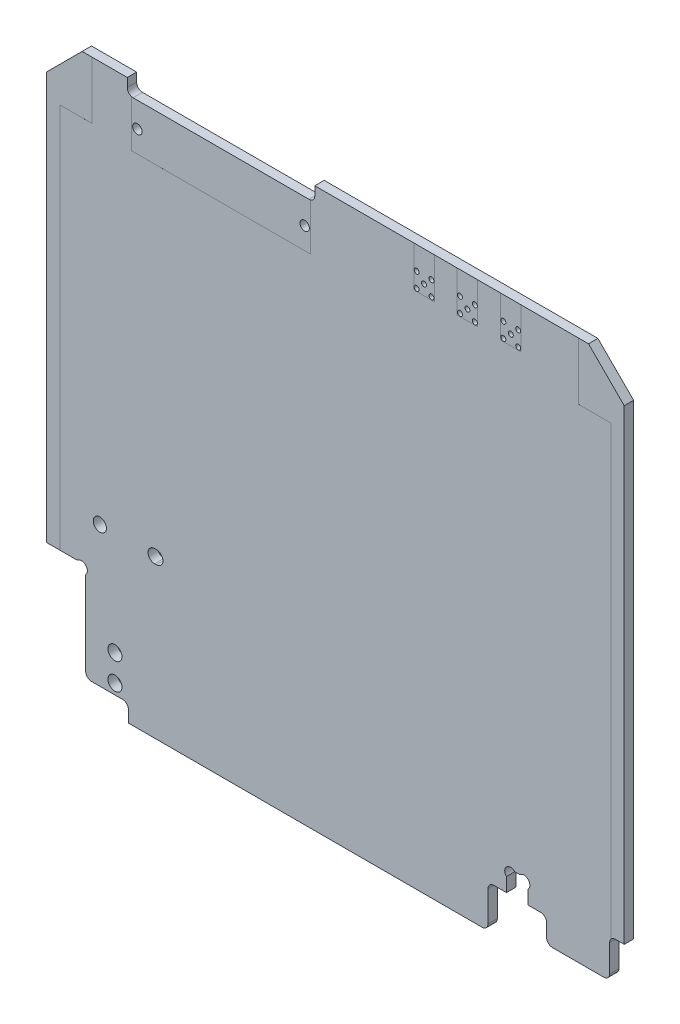
from build123d import *

# Parameters (mm, degrees)
SKETCH1_R           = 0.425
SKETCH1_R_2         = 0.8
BOSS_EXTRUDE1_DEPTH = 1.6
CUT_EXTRUDE1_DEPTH  = 0.0001
CUT_EXTRUDE2_DEPTH  = 0.0001
PARTFOOTPRINTS_W    = 30.48
PARTFOOTPRINTS_H    = 7.989227112
PARTFOOTPRINTS_W_2  = 3.5
PARTFOOTPRINTS_H_2  = 6.95
CUT_EXTRUDE3_DEPTH  = 0.0001
CUT_EXTRUDE4_DEPTH  = 71.235674696
SKETCH3_W           = 7.779754111
SKETCH3_H           = 5.155241991
CUT_EXTRUDE5_DEPTH  = 10
FILLET1_R           = 1
CUT_EXTRUDE6_DEPTH  = 71.235674696
FILLET2_R           = 1
SKETCH5_R           = 1.125
CUT_EXTRUDE7_DEPTH  = 71.235674696
SKETCH6_R           = 1.2
CUT_EXTRUDE8_DEPTH  = 71.235674696


with BuildPart() as part:
    # Sketch1 → Boss-Extrude1 (new body)
    with BuildSketch(Plane(origin=(0, 0, -0.0125), x_dir=(-1, 0, 0), z_dir=(0, 0, -1))):
        with BuildLine():
            Line((35.3, -50), (35.3, -48))
            ThreePointArc((35.3, -48), (35.592893219, -47.292893219), (36.3, -47))
            Line((36.3, -47), (45.8, -47))
            ThreePointArc((45.8, -47), (46.507106781, -46.707106781), (46.8, -46))
            Line((46.8, -46), (46.8, -41.4))
            ThreePointArc((46.8, -41.4), (47.092893219, -40.692893219), (47.8, -40.4))
            Line((47.8, -40.4), (49.3, -40.4))
            Line((49.3, -40.4), (49.3, 39.2))
            Line((49.3, 39.2), (43.2, 45.3))
            Line((43.2, 45.3), (35.500000002, 45.3))
            Line((35.500000002, 45.3), (35.500000002, 43.8))
            ThreePointArc((35.500000002, 43.8), (35.207106783, 43.092893219), (34.500000002, 42.8))
            Line((34.500000002, 42.8), (4.499999998, 42.8))
            ThreePointArc((4.499999998, 42.8), (3.792893217, 43.092893219), (3.499999998, 43.8))
            Line((3.499999998, 43.8), (3.499999998, 45.3))
            Line((3.499999998, 45.3), (-43.2, 45.3))
            Line((-43.2, 45.3), (-49.3, 39.2))
            Line((-49.3, 39.2), (-49.3, -40.4))
            Line((-49.3, -40.4), (-47.8, -40.4))
            ThreePointArc((-47.8, -40.4), (-47.092893219, -40.692893219), (-46.8, -41.4))
            Line((-46.8, -41.4), (-46.8, -46))
            ThreePointArc((-46.8, -46), (-46.507106781, -46.707106781), (-45.8, -47))
            Line((-45.8, -47), (-36.3, -47))
            ThreePointArc((-36.3, -47), (-35.592893219, -47.292893219), (-35.3, -48))
            Line((-35.3, -48), (-35.3, -50))
            Line((-35.3, -50), (35.3, -50))
        make_face()
        with Locations((-21.27, 41.37)):
            Circle(SKETCH1_R, mode=Mode.SUBTRACT)
        with Locations((-23.81, 41.37)):
            Circle(SKETCH1_R, mode=Mode.SUBTRACT)
        with Locations((-22.54, 40.1)):
            Circle(SKETCH1_R, mode=Mode.SUBTRACT)
        with Locations((-13.87, 41.37)):
            Circle(SKETCH1_R, mode=Mode.SUBTRACT)
        with Locations((-23.81, 38.83)):
            Circle(SKETCH1_R, mode=Mode.SUBTRACT)
        with Locations((-16.41, 41.37)):
            Circle(SKETCH1_R, mode=Mode.SUBTRACT)
        with Locations((-15.14, 40.1)):
            Circle(SKETCH1_R, mode=Mode.SUBTRACT)
        with Locations((-21.27, 38.83)):
            Circle(SKETCH1_R, mode=Mode.SUBTRACT)
        with Locations((-28.67, 41.37)):
            Circle(SKETCH1_R, mode=Mode.SUBTRACT)
        with Locations((-31.21, 41.37)):
            Circle(SKETCH1_R, mode=Mode.SUBTRACT)
        with Locations((-16.41, 38.83)):
            Circle(SKETCH1_R, mode=Mode.SUBTRACT)
        with Locations((-29.94, 40.1)):
            Circle(SKETCH1_R, mode=Mode.SUBTRACT)
        with Locations((-31.21, 38.83)):
            Circle(SKETCH1_R, mode=Mode.SUBTRACT)
        with Locations((-28.67, 38.83)):
            Circle(SKETCH1_R, mode=Mode.SUBTRACT)
        with Locations((33.775, 38.54)):
            Circle(SKETCH1_R_2, mode=Mode.SUBTRACT)
        with Locations((5.225, 38.54)):
            Circle(SKETCH1_R_2, mode=Mode.SUBTRACT)
        with Locations((-13.87, 38.83)):
            Circle(SKETCH1_R, mode=Mode.SUBTRACT)
    extrude(amount=-BOSS_EXTRUDE1_DEPTH)

    # thermalContacts_lower → Cut-Extrude1 (cut)
    with BuildSketch(Plane(origin=(0, 0, -0.0125), x_dir=(-1, 0, 0), z_dir=(0, 0, -1))):
        Polygon((47, 35.5), (47, -41.5), (59.827263463, -41.5), (59.827263463, 47), (41.5, 47), (41.5, 41.5), (41.5, 35.5), align=None)
        Polygon((-47, 35.5), (-47, -41.5), (-56.192158269, -41.5), (-56.192158269, 47), (-41.5, 47), (-41.5, 41.5), (-41.5, 35.5), align=None)
    extrude(amount=-CUT_EXTRUDE1_DEPTH, mode=Mode.SUBTRACT)

    # thermalContacts_upper → Cut-Extrude2 (cut)
    with BuildSketch(Plane.XY.offset(1.5875)):
        Polygon((-47, 35.5), (-47, -41.5), (-56.192158269, -41.5), (-56.192158269, 47), (-41.5, 47), (-41.5, 41.5), (-41.5, 35.5), align=None)
        Polygon((47, 35.5), (47, -41.5), (59.827263463, -41.5), (59.827263463, 47), (41.5, 47), (41.5, 41.5), (41.5, 35.5), align=None)
    extrude(amount=-CUT_EXTRUDE2_DEPTH, mode=Mode.SUBTRACT)

    # partFootprints → Cut-Extrude3 (cut)
    with BuildSketch(Plane.XY.offset(1.5875)):
        with Locations((-19.5, 38.834613556)):
            Rectangle(PARTFOOTPRINTS_W, PARTFOOTPRINTS_H)
        with Locations((15.14, 41.825)):
            Rectangle(PARTFOOTPRINTS_W_2, PARTFOOTPRINTS_H_2)
        with Locations((22.54, 41.825)):
            Rectangle(PARTFOOTPRINTS_W_2, PARTFOOTPRINTS_H_2)
        with Locations((29.94, 41.825)):
            Rectangle(PARTFOOTPRINTS_W_2, PARTFOOTPRINTS_H_2)
    extrude(amount=-CUT_EXTRUDE3_DEPTH, mode=Mode.SUBTRACT)

    # Sketch2 → Cut-Extrude4 (cut, through all)
    with BuildSketch(Plane.XY.offset(1.5875)):
        with BuildLine():
            Line((29.2, -42.8), (29.2, -40.414213562))
            ThreePointArc((29.2, -40.414213562), (29.2, -39), (30.614213562, -39))
            Line((30.614213562, -39), (31.485786438, -39))
            ThreePointArc((31.485786438, -39), (32.9, -39), (32.9, -40.414213562))
            Line((32.9, -40.414213562), (32.9, -42.8))
            Line((32.9, -42.8), (36.05, -42.8))
            Line((36.05, -42.8), (36.05, -50))
            Line((36.05, -50), (26.05, -50))
            Line((26.05, -50), (26.05, -42.8))
            Line((26.05, -42.8), (29.2, -42.8))
        make_face()
    extrude(amount=-CUT_EXTRUDE4_DEPTH, mode=Mode.SUBTRACT)

    # Sketch3 → Cut-Extrude5 (cut)
    with BuildSketch(Plane.XY.offset(1.5875)):
        with Locations((35.630924609, -49.577620995)):
            Rectangle(SKETCH3_W, SKETCH3_H)
    extrude(amount=-CUT_EXTRUDE5_DEPTH, mode=Mode.SUBTRACT)

    # Fillet1
    fillet1_edges = [part.edges().sort_by_distance(p)[0] for p in [
        (36.05, -42.8, 0.7875),
        (26.05, -42.8, 0.7875),
        (36.05, -47, 0.7875),
        (26.05, -50, 0.7875),
    ]]
    fillet(fillet1_edges, radius=FILLET1_R)

    # Sketch4 → Cut-Extrude6 (cut, through all)
    with BuildSketch(Plane.XY.offset(1.5875)):
        with BuildLine():
            Line((-51.38081647, -30.3), (-44.014213562, -30.3))
            ThreePointArc((-44.014213562, -30.3), (-42.6, -30.3), (-42.6, -31.714213562))
            Line((-42.6, -31.714213562), (-42.6, -47))
            Line((-42.6, -47), (-51.38081647, -47))
            Line((-51.38081647, -47), (-51.38081647, -30.3))
        make_face()
    extrude(amount=-CUT_EXTRUDE6_DEPTH, mode=Mode.SUBTRACT)

    # Fillet2
    fillet2_edges = [part.edges().sort_by_distance(p)[0] for p in [
        (-42.6, -47, 0.7875),
    ]]
    fillet(fillet2_edges, radius=FILLET2_R)

    # Sketch5 → Cut-Extrude7 (cut, through all)
    with BuildSketch(Plane.XY.offset(1.5875)):
        with Locations((-40.175, -23.1)):
            Circle(SKETCH5_R)
        with BuildLine():
            Line((-30.525, -24.225), (-30.825, -24.225))
            ThreePointArc((-30.825, -24.225), (-31.95, -23.1), (-30.825, -21.975))
            Line((-30.825, -21.975), (-30.525, -21.975))
            ThreePointArc((-30.525, -21.975), (-29.4, -23.1), (-30.525, -24.225))
        make_face()
    extrude(amount=-CUT_EXTRUDE7_DEPTH, mode=Mode.SUBTRACT)

    # Sketch6 → Cut-Extrude8 (cut, through all)
    with BuildSketch(Plane.XY.offset(1.5875)):
        with Locations((-37.6, -40.75)):
            Circle(SKETCH6_R)
        with Locations((-37.6, -45.25)):
            Circle(SKETCH6_R)
    extrude(amount=-CUT_EXTRUDE8_DEPTH, mode=Mode.SUBTRACT)


solid = part.part
